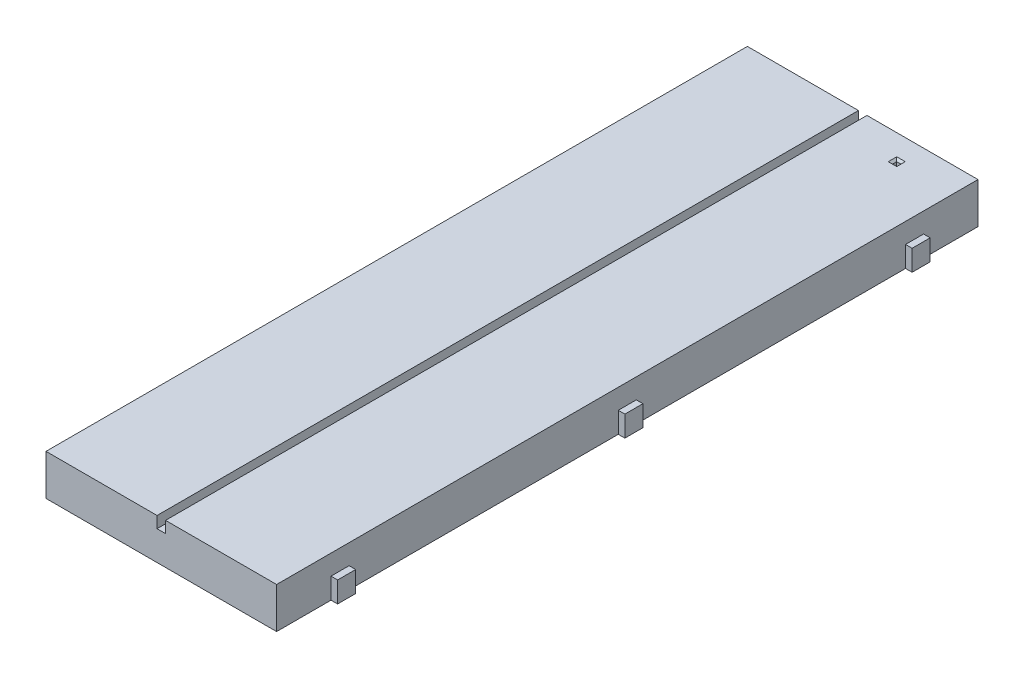
from build123d import *

# Parameters (mm, degrees)
SKETCH1_W                = 54.25
SKETCH1_H                = 165
BOSS_EXTRUDE1_DEPTH      = 9.6
BOSS_EXTRUDE2_DEPTH      = 1.55
BOSS_EXTRUDE2_DEPTH_BACK = 1.55
SKETCH2_W                = 4.25
SKETCH2_H                = 4.9
SKETCH15_W               = 4.25
SKETCH15_H               = 4.9
CUT_EXTRUDE1_DEPTH       = 1.55
SKETCH17_W               = 2
SKETCH17_H               = 165
CUT_EXTRUDE2_DEPTH       = 2.7
SKETCH18_W               = 1
SKETCH18_H               = 1
CUT_EXTRUDE3_DEPTH       = 5
CHAMFER1_SIZE            = 0.5


with BuildPart() as part:
    # Sketch1 → Boss-Extrude1 (new body)
    with BuildSketch(Plane(origin=(0, 0, 0), x_dir=(1, 0, 0), z_dir=(0, 1, 0))):
        Rectangle(SKETCH1_W, SKETCH1_H)
    extrude(amount=-BOSS_EXTRUDE1_DEPTH)

    # Sketch2 → Boss-Extrude2 (add, two sides: drawn at the far end of the back side and taken through both)
    with BuildSketch(Plane(origin=(27.125, 0, 0), x_dir=(0, 0, -1), z_dir=(1, 0, 0)).offset(-BOSS_EXTRUDE2_DEPTH_BACK)):
        with Locations((67.575, -7.15)):
            Rectangle(SKETCH2_W, SKETCH2_H)
        with Locations((-67.575, -7.15)):
            Rectangle(SKETCH2_W, SKETCH2_H)
        with Locations((0, -7.15)):
            Rectangle(SKETCH2_W, SKETCH2_H)
    extrude(amount=BOSS_EXTRUDE2_DEPTH + BOSS_EXTRUDE2_DEPTH_BACK)

    # Sketch15 → Cut-Extrude1 (cut)
    with BuildSketch(Plane.ZY.offset(27.125)):
        with Locations((67.575, -7.15)):
            Rectangle(SKETCH15_W, SKETCH15_H)
        with Locations((-67.575, -7.15)):
            Rectangle(SKETCH15_W, SKETCH15_H)
        with Locations((0, -7.15)):
            Rectangle(SKETCH15_W, SKETCH15_H)
    extrude(amount=-CUT_EXTRUDE1_DEPTH, mode=Mode.SUBTRACT)

    # Sketch17 → Cut-Extrude2 (cut)
    with BuildSketch(Plane(origin=(0, 0, 0), x_dir=(1, 0, 0), z_dir=(0, 1, 0))):
        Rectangle(SKETCH17_W, SKETCH17_H)
    extrude(amount=-CUT_EXTRUDE2_DEPTH, mode=Mode.SUBTRACT)

    # Sketch18 → Cut-Extrude3 (cut)
    with BuildSketch(Plane(origin=(0, 0, 0), x_dir=(1, 0, 0), z_dir=(0, 1, 0))):
        with Locations((13.925, 76.580733968)):
            Rectangle(SKETCH18_W, SKETCH18_H)
    extrude(amount=-CUT_EXTRUDE3_DEPTH, mode=Mode.SUBTRACT)

    # Chamfer1
    chamfer1_edges = [part.edges().sort_by_distance(p)[0] for p in [
        (13.425, 0, -76.580733968),
        (13.925, 0, -76.080733968),
        (14.425, 0, -76.580733968),
        (13.925, 0, -77.080733968),
    ]]
    chamfer(chamfer1_edges, length=CHAMFER1_SIZE)


solid = part.part
